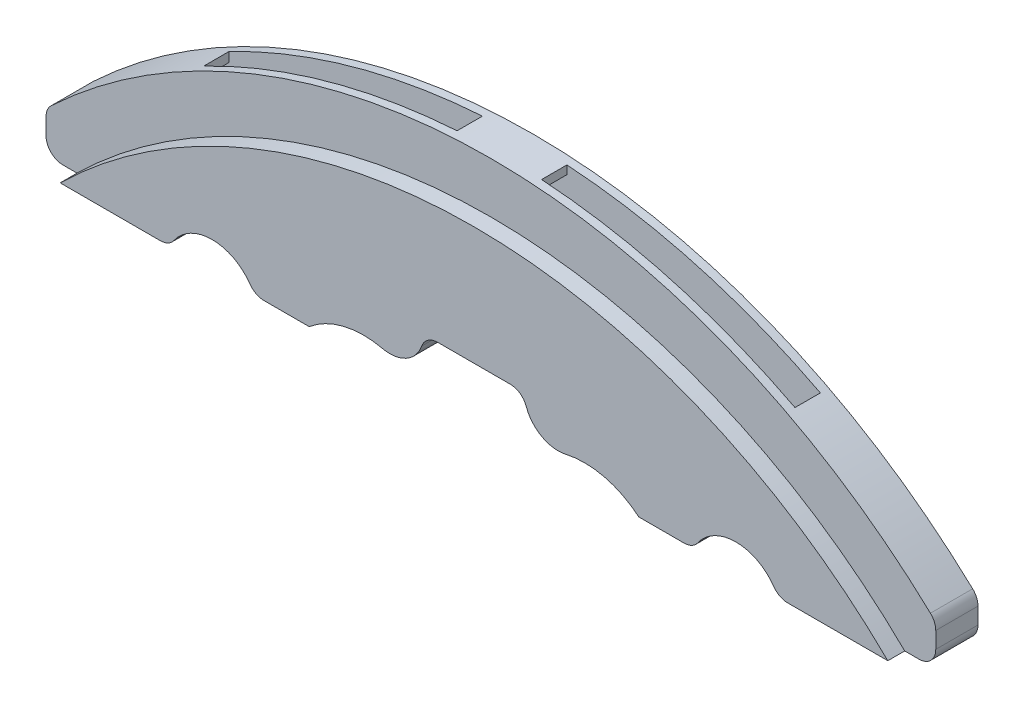
from build123d import *

# Parameters (mm, degrees)
BOSS_EXTRUDE1_DEPTH = 2.5
SHELL1_START        = -1.5
SHELL1_DEPTH        = 3
BOSS_EXTRUDE2_START = 2
BOSS_EXTRUDE2_DEPTH = 2
SKETCH4_W           = 30
SKETCH4_H           = 3
CUT_EXTRUDE1_DEPTH  = 100


# Read off the part's stored shape, not the designer's step: Shell1
with BuildPart() as part:
    # Sketch1 → Boss-Extrude1 (new, symmetric)
    with BuildSketch(Plane.XY):
        with BuildLine():
            ThreePointArc((-50.662558564, 50), (-52.076772126, 50.585786438), (-52.662558564, 52))
            Line((-52.662558564, 52), (-52.662558564, 53.937975118))
            ThreePointArc((-52.662558564, 53.937975118), (-52.498112524, 54.732167576), (-52.031816903, 55.395758229))
            ThreePointArc((-52.031816903, 55.395758229), (0, 76), (52.031816903, 55.395758229))
            ThreePointArc((52.031816903, 55.395758229), (52.498112524, 54.732167576), (52.662558564, 53.937975118))
            Line((52.662558564, 53.937975118), (52.662558564, 52))
            ThreePointArc((52.662558564, 52), (52.076772126, 50.585786438), (50.662558564, 50))
            Line((50.662558564, 50), (48.989794856, 50))
            ThreePointArc((48.989794856, 50), (0, 70), (-48.989794856, 50))
            Line((-48.989794856, 50), (-50.662558564, 50))
        make_face()
        with BuildLine():
            ThreePointArc((4.302180061, 56), (5.456880599, 55.632993162), (6.187798144, 54.666666667))
            ThreePointArc((6.187798144, 54.666666667), (8.029260752, 52.496291392), (10.847853752, 52.1))
            ThreePointArc((10.847853752, 52.1), (15.425940788, 52.068491802), (19.510205144, 50))
            Line((19.510205144, 50), (24.864501465, 50))
            ThreePointArc((24.864501465, 50), (25.78632175, 50.22510638), (26.500634408, 50.849752638))
            ThreePointArc((26.500634408, 50.849752638), (31, 53.186572392), (35.499365592, 50.849752638))
            ThreePointArc((35.499365592, 50.849752638), (36.21367825, 50.22510638), (37.135498535, 50))
            Line((37.135498535, 50), (48.989794856, 50))
            ThreePointArc((48.989794856, 50), (0, 70), (-48.989794856, 50))
            Line((-48.989794856, 50), (-37.135498535, 50))
            ThreePointArc((-37.135498535, 50), (-36.21367825, 50.22510638), (-35.499365592, 50.849752638))
            ThreePointArc((-35.499365592, 50.849752638), (-31, 53.186572392), (-26.500634408, 50.849752638))
            ThreePointArc((-26.500634408, 50.849752638), (-25.78632175, 50.22510638), (-24.864501465, 50))
            Line((-24.864501465, 50), (-19.510205144, 50))
            ThreePointArc((-19.510205144, 50), (-15.425940788, 52.068491802), (-10.847853752, 52.1))
            ThreePointArc((-10.847853752, 52.1), (-8.029260752, 52.496291392), (-6.187798144, 54.666666667))
            ThreePointArc((-6.187798144, 54.666666667), (-5.456880599, 55.632993162), (-4.302180061, 56))
            Line((-4.302180061, 56), (4.302180061, 56))
        make_face()
    extrude(amount=BOSS_EXTRUDE1_DEPTH, both=True)

    # Shell1 outline → Shell1 (cut)
    with BuildSketch(Plane.XY.offset(SHELL1_START)):
        with BuildLine():
            Line((37.135498535, 50), (50.662558564, 50))
            Line((50.662558564, 50), (50.662558564, 51))
            ThreePointArc((50.662558564, 51), (51.369665345, 51.292893219), (51.662558564, 52))
            Line((51.662558564, 52), (51.662558564, 53.937975118))
            ThreePointArc((51.662558564, 53.937975118), (51.580335544, 54.335071347), (51.347187733, 54.666866673))
            ThreePointArc((51.347187733, 54.666866673), (0, 75), (-51.347187733, 54.666866673))
            ThreePointArc((-51.347187733, 54.666866673), (-51.580335544, 54.335071347), (-51.662558564, 53.937975118))
            Line((-51.662558564, 53.937975118), (-51.662558564, 52))
            ThreePointArc((-51.662558564, 52), (-51.369665345, 51.292893219), (-50.662558564, 51))
            Line((-50.662558564, 51), (-50.662558564, 50))
            Line((-50.662558564, 50), (-37.135498535, 50))
            ThreePointArc((-37.135498535, 50), (-36.21367825, 50.22510638), (-35.499365592, 50.849752638))
            ThreePointArc((-35.499365592, 50.849752638), (-31, 53.186572392), (-26.500634408, 50.849752638))
            ThreePointArc((-26.500634408, 50.849752638), (-25.78632175, 50.22510638), (-24.864501465, 50))
            Line((-24.864501465, 50), (-19.510205144, 50))
            ThreePointArc((-19.510205144, 50), (-15.425940787, 52.068491802), (-10.847853752, 52.1))
            ThreePointArc((-10.847853752, 52.1), (-8.029260752, 52.496291392), (-6.187798144, 54.666666667))
            ThreePointArc((-6.187798144, 54.666666667), (-5.456880599, 55.632993162), (-4.302180061, 56))
            Line((-4.302180061, 56), (4.302180061, 56))
            ThreePointArc((4.302180061, 56), (5.456880599, 55.632993162), (6.187798144, 54.666666667))
            ThreePointArc((6.187798144, 54.666666667), (8.029260752, 52.496291392), (10.847853752, 52.1))
            ThreePointArc((10.847853752, 52.1), (15.425940787, 52.068491802), (19.510205144, 50))
            Line((19.510205144, 50), (24.864501465, 50))
            ThreePointArc((24.864501465, 50), (25.78632175, 50.22510638), (26.500634408, 50.849752638))
            ThreePointArc((26.500634408, 50.849752638), (31, 53.186572392), (35.499365592, 50.849752638))
            ThreePointArc((35.499365592, 50.849752638), (36.21367825, 50.22510638), (37.135498535, 50))
        make_face()
    extrude(amount=SHELL1_DEPTH, mode=Mode.SUBTRACT)

    # Sketch3 → Boss-Extrude2 (add)
    with BuildSketch(Plane.XY.offset(2.5).offset(BOSS_EXTRUDE2_START)):
        with BuildLine():
            ThreePointArc((48.989794856, 50), (0, 70), (-48.989794856, 50))
            Line((-48.989794856, 50), (-37.135498535, 50))
            ThreePointArc((-37.135498535, 50), (-36.21367825, 50.22510638), (-35.499365592, 50.849752638))
            ThreePointArc((-35.499365592, 50.849752638), (-31, 53.186572392), (-26.500634408, 50.849752638))
            ThreePointArc((-26.500634408, 50.849752638), (-25.78632175, 50.22510638), (-24.864501465, 50))
            Line((-24.864501465, 50), (-19.510205144, 50))
            ThreePointArc((-19.510205144, 50), (-15.425940788, 52.068491802), (-10.847853752, 52.1))
            ThreePointArc((-10.847853752, 52.1), (-8.029260752, 52.496291392), (-6.187798144, 54.666666667))
            ThreePointArc((-6.187798144, 54.666666667), (-5.456880599, 55.632993162), (-4.302180061, 56))
            Line((-4.302180061, 56), (4.302180061, 56))
            ThreePointArc((4.302180061, 56), (5.456880599, 55.632993162), (6.187798144, 54.666666667))
            ThreePointArc((6.187798144, 54.666666667), (8.029260752, 52.496291392), (10.847853752, 52.1))
            ThreePointArc((10.847853752, 52.1), (15.425940788, 52.068491802), (19.510205144, 50))
            Line((19.510205144, 50), (24.864501465, 50))
            ThreePointArc((24.864501465, 50), (25.78632175, 50.22510638), (26.500634408, 50.849752638))
            ThreePointArc((26.500634408, 50.849752638), (31, 53.186572392), (35.499365592, 50.849752638))
            ThreePointArc((35.499365592, 50.849752638), (36.21367825, 50.22510638), (37.135498535, 50))
            Line((37.135498535, 50), (48.989794856, 50))
        make_face()
    extrude(amount=-BOSS_EXTRUDE2_DEPTH)

    # Sketch4 → Cut-Extrude1 (cut, symmetric)
    with BuildSketch(Plane(origin=(0, 0, 0), x_dir=(1, 0, 0), z_dir=(0, 1, 0))):
        with Locations((-20, 0)):
            Rectangle(SKETCH4_W, SKETCH4_H)
        with Locations((20, 0)):
            Rectangle(SKETCH4_W, SKETCH4_H)
    extrude(amount=CUT_EXTRUDE1_DEPTH, both=True, mode=Mode.SUBTRACT)


solid = part.part
